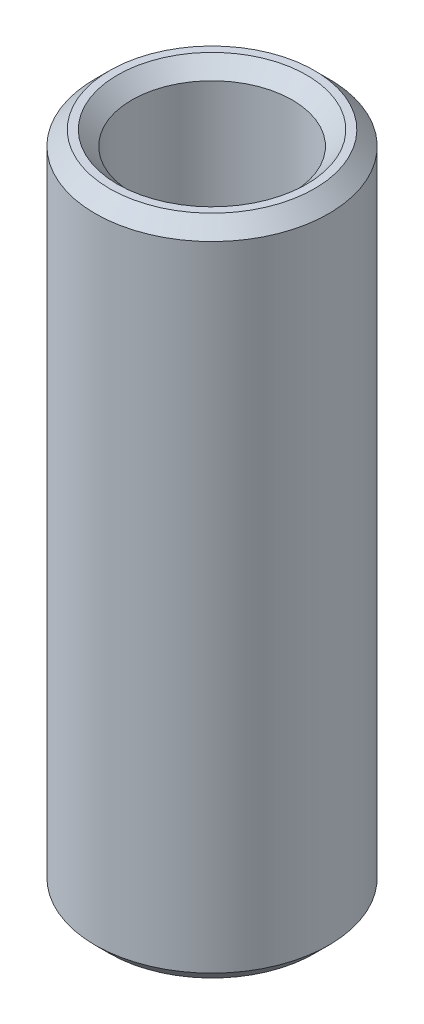
from build123d import *

# Parameters (mm, degrees)
SKETCH1_R           = 27.5
BOSS_EXTRUDE1_DEPTH = 155.965716364
SKETCH2_R           = 18.885025836
CUT_EXTRUDE1_DEPTH  = 161.741421796
CHAMFER1_SIZE       = 3.389615635


with BuildPart() as part:
    # Sketch1 → Boss-Extrude1 (new body)
    with BuildSketch(Plane(origin=(0, 0, 0), x_dir=(1, 0, 0), z_dir=(0, 1, 0))):
        Circle(SKETCH1_R)
    extrude(amount=BOSS_EXTRUDE1_DEPTH)

    # Sketch2 → Cut-Extrude1 (cut, through all)
    with BuildSketch(Plane(origin=(0, 0, 0), x_dir=(1, 0, 0), z_dir=(0, 1, 0))):
        Circle(SKETCH2_R)
    extrude(amount=CUT_EXTRUDE1_DEPTH, mode=Mode.SUBTRACT)

    # Chamfer1
    chamfer1_edges = [part.edges().sort_by_distance(p)[0] for p in [
        (-18.885025836, 155.965716364, 0),
        (-18.885025836, 0, 0),
        (-27.5, 0, 0),
        (-27.5, 155.965716364, 0),
    ]]
    chamfer(chamfer1_edges, length=CHAMFER1_SIZE)


solid = part.part
